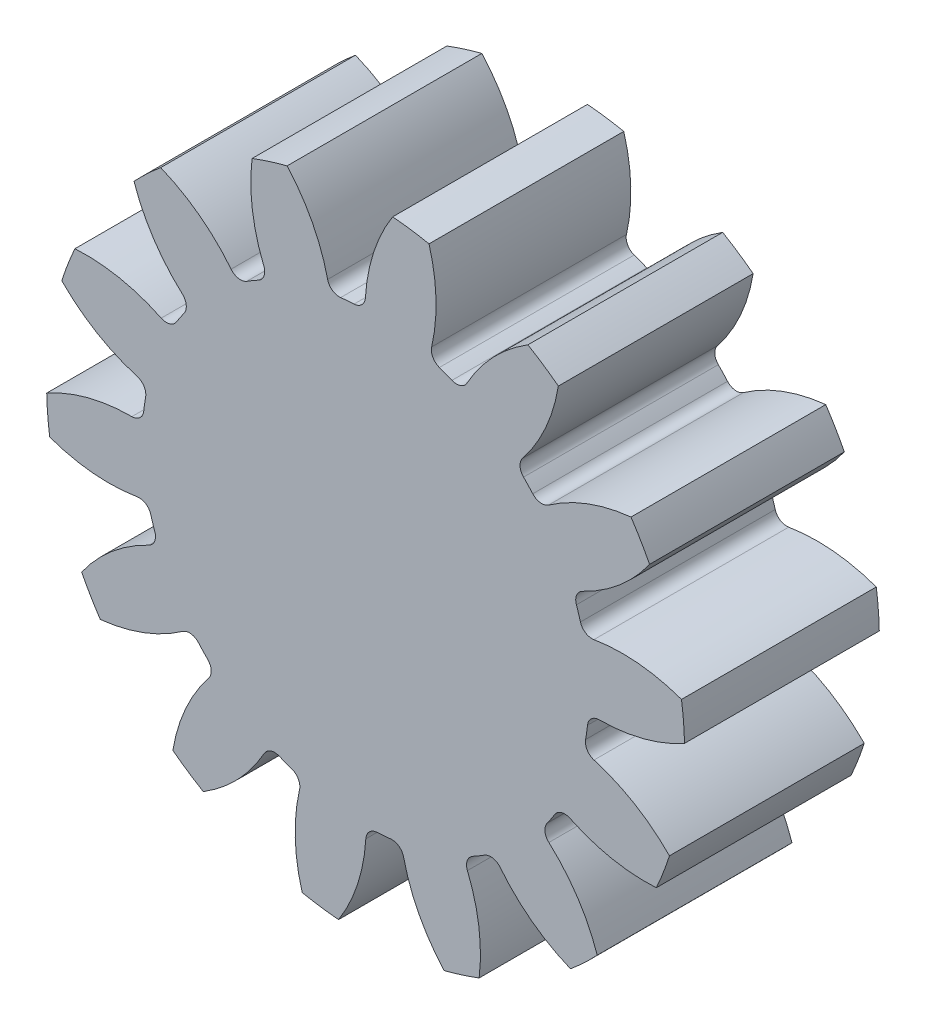
from build123d import *

# Parameters (mm, degrees)
SKETCH1_R                = 10.39999952
BOSS_EXTRUDE1_DEPTH      = 3.175
CUT_EXTRUDE2_DEPTH       = 17.02006492
FILLET3_R                = 0.389999982
CIRPATTERN3_COUNT        = 14
FILLET3_OF_CIRPATTERN3_R = 0.389999982


with BuildPart() as part:
    # Sketch1 → Boss-Extrude1 (new, symmetric)
    with BuildSketch(Plane.XY):
        Circle(SKETCH1_R)
    extrude(amount=BOSS_EXTRUDE1_DEPTH, both=True)

    # Sketch5 → Cut-Extrude2 (cut, through all)
    with BuildSketch(Plane(origin=(0, 0, 3.175), x_dir=(0.996648616832647, 0.08180180050323896, 0), z_dir=(0, 0, 1))):
        with BuildLine():
            ThreePointArc((-2.53673854, 11.114177731), (-1.176112101, 9.379215506), (-0.578072094, 7.257012317))
            ThreePointArc((-0.578072094, 7.257012317), (0, 7.279999664), (0.578072094, 7.257012317))
            ThreePointArc((0.578072094, 7.257012317), (1.176112101, 9.379215506), (2.53673854, 11.114177731))
            ThreePointArc((2.53673854, 11.114177731), (0, 11.39999952), (-2.53673854, 11.114177731))
        make_face()
    cut_extrude2 = extrude(amount=-CUT_EXTRUDE2_DEPTH, mode=Mode.SUBTRACT)

    # Fillet3
    fillet3_edges = [part.edges().sort_by_distance(p)[0] for p in [
        (-1.169771427, 7.185403949, 0),
        (-0.017501921, 7.279978626, 0),
    ]]
    fillet(fillet3_edges, radius=FILLET3_R)

    # CirPattern3: Cut-Extrude2 ×14 about axis
    cirpattern3_axis = Axis((0, 0, 3.175), (0, 0, -1))
    for i in range(1, CIRPATTERN3_COUNT):
        add(cut_extrude2.rotate(cirpattern3_axis, i * 360 / CIRPATTERN3_COUNT), mode=Mode.SUBTRACT)

    # Fillet3 of CirPattern3
    fillet3_of_cirpattern3_edges = [part.edges().sort_by_distance(p)[0] for p in [
        (2.063702295, 6.981370062, 0),
        (3.142895661, 6.5666279, 0),
        (4.888434467, 5.394590213, 0),
        (5.680804212, 4.552675984, 0),
        (6.74495224, 2.739345612, 0),
        (7.093559819, 1.637010754, 0),
        (7.265549501, -0.458459983, 0),
        (7.101348906, -1.602884532, 0),
        (6.347115577, -3.565461956, 0),
        (5.70262875, -4.525308878, 0),
        (4.171557571, -5.966280461, 0),
        (3.174433033, -6.551440302, 0),
        (1.169771427, -7.185403949, 0),
        (0.017501921, -7.279978626, 0),
        (-2.063702295, -6.981370062, 0),
        (-3.142895661, -6.5666279, 0),
        (-4.888434467, -5.394590213, 0),
        (-5.680804212, -4.552675984, 0),
        (-6.74495224, -2.739345612, 0),
        (-7.093559819, -1.637010754, 0),
        (-7.265549501, 0.458459983, 0),
        (-7.101348906, 1.602884532, 0),
        (-6.347115577, 3.565461956, 0),
        (-5.70262875, 4.525308878, 0),
        (-4.171557571, 5.966280461, 0),
        (-3.174433033, 6.551440302, 0),
    ]]
    fillet(fillet3_of_cirpattern3_edges, radius=FILLET3_OF_CIRPATTERN3_R)


solid = part.part
